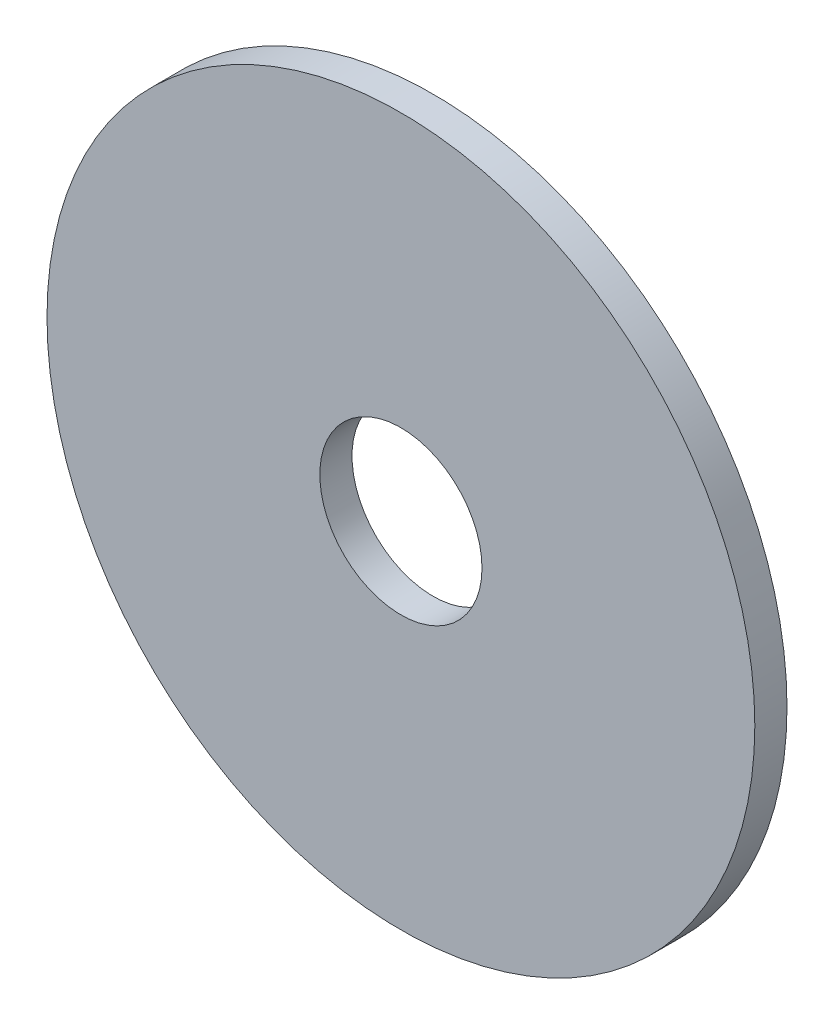
from build123d import *

# Parameters (mm, degrees)
SKETCH1_R           = 34.925
SKETCH1_R_2         = 8.001
BOSS_EXTRUDE1_DEPTH = 3.175


with BuildPart() as part:
    # Sketch1 → Boss-Extrude1 (new body)
    with BuildSketch(Plane.XY):
        Circle(SKETCH1_R)
        Circle(SKETCH1_R_2, mode=Mode.SUBTRACT)
    extrude(amount=BOSS_EXTRUDE1_DEPTH)


solid = part.part
